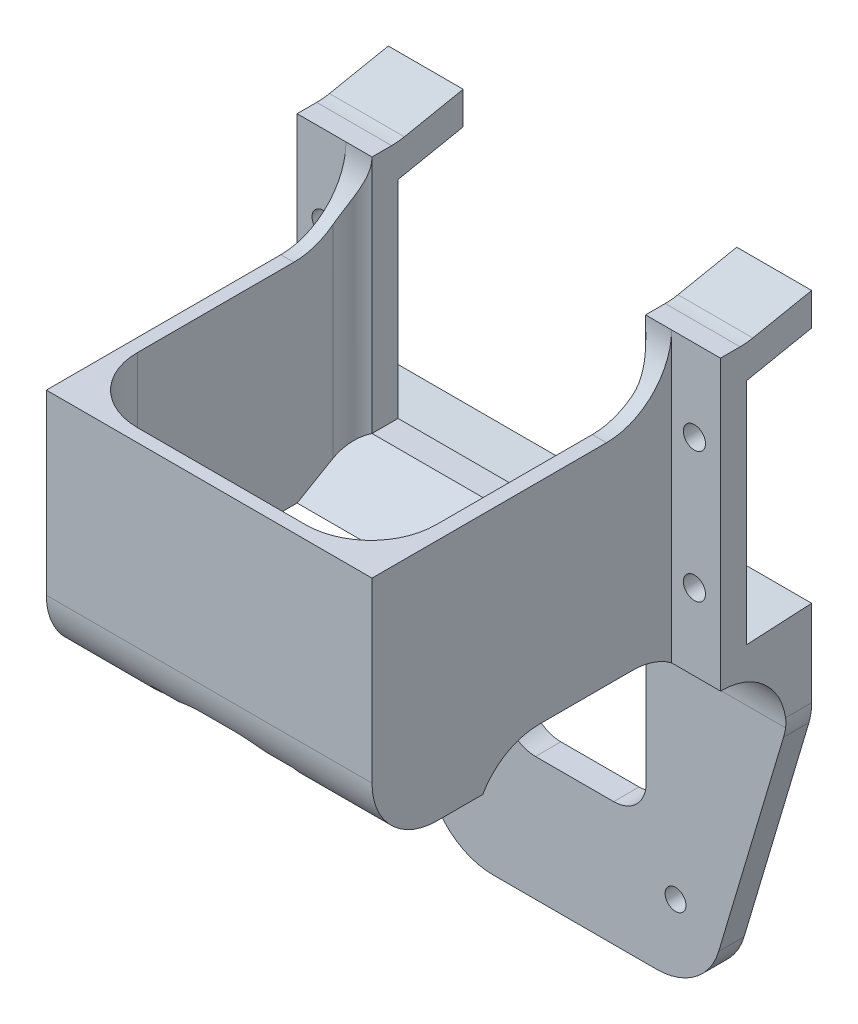
from build123d import *

# Parameters (mm, degrees)
SKETCH1_R            = 1.7
BOSS_EXTRUDE1_DEPTH  = 4
BOSS_EXTRUDE7_DEPTH  = 65
SKETCH9_W            = 42
SKETCH9_H            = 10.1
CUT_EXTRUDE2_DEPTH   = 2
SKETCH4_W            = 65
SKETCH4_H            = 3.9
BOSS_EXTRUDE3_DEPTH  = 52
SKETCH5_R            = 1.6
CUT_EXTRUDE1_DEPTH   = 50
BOSS_EXTRUDE8_START  = -10
BOSS_EXTRUDE8_DEPTH  = 32.27
FILLET1_R            = 10
BOSS_EXTRUDE9_DEPTH  = 11.5
BOSS_EXTRUDE12_START = -65
BOSS_EXTRUDE12_DEPTH = 11.5
FILLET5_R            = 10
SKETCH14_W           = 12
SKETCH14_H           = 15
SKETCH14_W_2         = 11.826086957
BOSS_EXTRUDE10_DEPTH = 5
FILLET3_R            = 10
SKETCH15_W           = 22
SKETCH15_H           = 30
CUT_EXTRUDE3_DEPTH   = 10
FILLET6_R            = 5
FILLET7_R            = 10
BOSS_EXTRUDE13_REACH = 95.361
FILLET8_R            = 10
FILLET9_R            = 5
FILLET10_START       = -2
FILLET10_DEPTH       = 32.27
FILLET10_START_2     = -32.5
FILLET10_2_DEPTH     = 65
FILLET10_START_3     = 20.99999979
FILLET10_3_DEPTH     = 4.00000021
FILLET10_START_4     = -25
FILLET10_4_DEPTH     = 4
FILLET10_START_5     = 30.27
FILLET10_5_DEPTH     = 12.000012257


with BuildPart() as part:
    # Sketch1 → Boss-Extrude1 (new body)
    with BuildSketch(Plane.XY):
        Polygon((-21, 40.27), (-21, 3.5), (21, 3.5), (21, 40.27), (32.5, 40.27), (32.5, 0), (-32.5, 0), (-32.5, 40.27), align=None)
        with Locations((-28.5, 27.73)):
            Circle(SKETCH1_R, mode=Mode.SUBTRACT)
        with Locations((-28.5, 7.73)):
            Circle(SKETCH1_R, mode=Mode.SUBTRACT)
        with Locations(Location((28.5, 7.73, 0), (0, 0, 180))):
            Circle(SKETCH1_R, mode=Mode.SUBTRACT)
        with Locations(Location((28.5, 27.73, 0), (0, 0, 180))):
            Circle(SKETCH1_R, mode=Mode.SUBTRACT)
    extrude(amount=BOSS_EXTRUDE1_DEPTH)

    # Sketch7 → Boss-Extrude7 (add)
    with BuildSketch(Plane(origin=(32.5, 0, 0), x_dir=(0, 0, -1), z_dir=(1, 0, 0))):
        Polygon((0, 0), (-4, 0), (-4, -4), (10, -4), (10, 0.674077793), (0, 0.15), align=None)
    extrude(amount=-BOSS_EXTRUDE7_DEPTH)

    # Sketch9 → Cut-Extrude2 (cut)
    with BuildSketch(Plane.XZ.offset(4)):
        with Locations((0, -1.05)):
            Rectangle(SKETCH9_W, SKETCH9_H)
    extrude(amount=-CUT_EXTRUDE2_DEPTH, mode=Mode.SUBTRACT)

    # Sketch4 → Boss-Extrude3 (add)
    with BuildSketch(Plane.XZ.offset(4)):
        with Locations((0, -8.05)):
            Rectangle(SKETCH4_W, SKETCH4_H)
    extrude(amount=BOSS_EXTRUDE3_DEPTH)

    # Sketch5 → Cut-Extrude1 (cut)
    with BuildSketch(Plane.XY.offset(-10)):
        with Locations(Location((-15.5, -45.25, 0), (0, 0, 180))):
            Circle(SKETCH5_R)
        with Locations(Location((15.5, -45.25, 0), (0, 0, 180))):
            Circle(SKETCH5_R)
    extrude(amount=CUT_EXTRUDE1_DEPTH, mode=Mode.SUBTRACT)

    # Sketch11 → Boss-Extrude8 (add)
    with BuildSketch(Plane(origin=(0, 40.27, 0), x_dir=(1, 0, 0), z_dir=(0, 1, 0)).offset(BOSS_EXTRUDE8_START)):
        Polygon((-23, -4), (-25, -4), (-25, -50), (25, -50), (25, -4), (22.826086957, -4), (22.826086957, -48), (-23, -48), align=None)
    extrude(amount=-BOSS_EXTRUDE8_DEPTH)

    # Fillet1
    fillet1_edges = [part.edges().sort_by_distance(p)[0] for p in [
        (-26.75, -4, -6.1),
        (26.75, -4, -6.1),
    ]]
    fillet(fillet1_edges, radius=FILLET1_R)

    # Sketch13 → Boss-Extrude9 (add)
    with BuildSketch(Plane(origin=(32.5, 0, 0), x_dir=(0, 0, -1), z_dir=(1, 0, 0))):
        Polygon((10, 42.270012257), (0, 40.27), (0, 35.27), (10, 37.270012257), align=None)
    extrude(amount=-BOSS_EXTRUDE9_DEPTH)

    # Sketch13<8> → Boss-Extrude12 (add)
    with BuildSketch(Plane(origin=(32.5, 0, 0), x_dir=(0, 0, -1), z_dir=(1, 0, 0)).offset(BOSS_EXTRUDE12_START)):
        Polygon((0, 40.27), (10, 42.270012257), (10, 37.270012257), (0, 35.27), align=None)
    extrude(amount=BOSS_EXTRUDE12_DEPTH)

    # Fillet5
    fillet5_edges = [part.edges().sort_by_distance(p)[0] for p in [
        (-26.75, 40.27, 0),
        (26.75, 40.27, 0),
    ]]
    fillet(fillet5_edges, radius=FILLET5_R)

    # Sketch14 → Boss-Extrude10 (add)
    with BuildSketch(Plane.XZ.offset(2)):
        with Locations((-17, 40.5)):
            Rectangle(SKETCH14_W, SKETCH14_H)
        with Locations((16.913043479, 40.5)):
            Rectangle(SKETCH14_W_2, SKETCH14_H)
        Polygon((25, 50), (11, 50), (11, 48), (22.826086957, 48), (22.826086957, 33), (25, 33), align=None)
        Polygon((-11, 50), (-25, 50), (-25, 33), (-23, 33), (-23, 48), (-11, 48), align=None)
    extrude(amount=BOSS_EXTRUDE10_DEPTH)

    # Fillet3
    # the kernel refuses this fillet: 10 mm, written as the material it adds along each edge
    with BuildSketch(Plane(origin=(22.826086957, -2, 33), x_dir=(0, -1, 0), z_dir=(1, 0, 0))) as fillet3_piece_1:
        with BuildLine():
            CenterArc((10, 8.660254038), FILLET3_R, 180, 60)
            Line((0, 8.660254038), (0, 0))
            Line((0, 0), (5, 0))
        make_face()
    extrude(amount=2.173913043)
    with BuildSketch(Plane(origin=(-25, -2, 33), x_dir=(0, -1, 0), z_dir=(1, 0, 0)), Plane(origin=(11, -2, 50), x_dir=(0, -1, 0), z_dir=(0, 0, -1))) as fillet3_piece_2:
        with BuildLine():
            CenterArc((10, 8.660254038), FILLET3_R, 180, 60)
            Line((0, 8.660254038), (0, 0))
            Line((0, 0), (5, 0))
        make_face()
    extrude(amount=2)
    with BuildSketch(Plane(origin=(-11, -2, 48), x_dir=(1, 0, 0), z_dir=(0, 0, 1))) as fillet3_piece_3:
        with BuildLine():
            CenterArc((8.660254038, -10), FILLET3_R, 90, 60)
            Line((0, -5), (0, 0))
            Line((0, 0), (8.660254038, 0))
        make_face()
    extrude(amount=2)

    # Sketch15 → Cut-Extrude3 (cut)
    with BuildSketch(Plane.XY.offset(-6.1)):
        with Locations((0, -22)):
            Rectangle(SKETCH15_W, SKETCH15_H)
        Polygon((-32.5, -14), (-20, -56), (-32.5, -56), align=None)
        Polygon((32.5, -56), (20, -56), (32.5, -14), align=None)
    extrude(amount=-CUT_EXTRUDE3_DEPTH, mode=Mode.SUBTRACT)

    # Fillet6
    fillet6_edges = [part.edges().sort_by_distance(p)[0] for p in [
        (-11, -37, -8.05),
        (-11, -7, -8.05),
        (11, -7, -8.05),
        (11, -37, -8.05),
    ]]
    fillet(fillet6_edges, radius=FILLET6_R)

    # Fillet7
    fillet7_edges = [part.edges().sort_by_distance(p)[0] for p in [
        (-20, -56, -8.05),
        (-32.5, -14, -8.05),
        (32.5, -14, -8.05),
        (20, -56, -8.05),
    ]]
    fillet(fillet7_edges, radius=FILLET7_R)

    # Boss-Extrude13: up to this face of the body (flat: up to its plane)
    boss_extrude13_end = Plane(part.part.faces().sort_by_distance((22.826086957, 13.980833311, 26.043580166))[0])
    # Sketch16 → Boss-Extrude13 (add, up to the picked face)
    with BuildSketch(Plane(origin=(-23, 0, 0), x_dir=(0, 0, -1), z_dir=(1, 0, 0)), mode=Mode.PRIVATE) as boss_extrude13_sk1:
        Polygon((-4, -2), (-4, 3.5), (-13.5, -2), align=None)
    boss_extrude13_tool1 = split(extrude(boss_extrude13_sk1.sketch, amount=BOSS_EXTRUDE13_REACH, mode=Mode.PRIVATE), bisect_by=boss_extrude13_end, keep=Keep.BOTH, mode=Mode.PRIVATE)
    add(boss_extrude13_tool1.solids().sort_by(Axis((-23, -0.166667, 7.166667), (1, 0, 0)))[0])

    # Fillet8
    # the kernel refuses this fillet: 10 mm, written as the material it adds along each edge
    with BuildSketch(Plane(origin=(-21, -2, 4), x_dir=(0, -1, 0), z_dir=(-1, 0, 0)), Plane(origin=(25, -2, 4), x_dir=(0, -1, 0), z_dir=(-1, 0, 0))) as fillet8_piece_1:
        with BuildLine():
            CenterArc((10, 6), FILLET8_R, 180, 36.869897646)
            Line((0, 6), (-0.2, 6))
            Line((-0.2, 6), (-0.2, 0))
            Line((-0.2, 0), (0, -0.2))
            ThreePointArc((0, -0.2), (1, -0.2), (1.84, -0.12))
            Line((1.84, -0.12), (2, 0))
        make_face()
    extrude(amount=4)

    # Fillet9
    # the kernel refuses this fillet: 5 mm, written as the material it adds along each edge
    with BuildSketch(Plane(origin=(22.826086957, 30.27, 4), x_dir=(-1, 0, 0), z_dir=(0, -1, 0))) as fillet9_piece_1_section:
        with BuildLine():
            CenterArc((5, -3.863453894), FILLET9_R, 129.403862825, 50.596137175)
            Line((0, -3.863453894), (0, 0))
            Line((0, 0), (1.826086957, 0))
        make_face()
    fillet9_piece_1 = extrude(amount=36.428634735, mode=Mode.PRIVATE)
    fillet9_piece_1 = split(fillet9_piece_1, bisect_by=Plane(origin=(22.826086957, -2, 4), z_dir=(0, 1, 0)), keep=Keep.TOP, mode=Mode.PRIVATE)
    add(fillet9_piece_1)
    with BuildSketch(Plane(origin=(-23, 30.27, 4), x_dir=(0, 0, 1), z_dir=(0, -1, 0))) as fillet9_piece_2_section:
        with BuildLine():
            CenterArc((4, -5), FILLET9_R, 90, 53.130102354)
            Line((0, -2), (0, 0))
            Line((0, 0), (4, 0))
        make_face()
    fillet9_piece_2 = extrude(amount=36.77, mode=Mode.PRIVATE)
    fillet9_piece_2 = split(fillet9_piece_2, bisect_by=Plane(origin=(-23, -2, 4), z_dir=(0, 1, 0)), keep=Keep.TOP, mode=Mode.PRIVATE)
    add(fillet9_piece_2)

    # Fillet10: read off the stored shape, not the designer's step
    # Fillet10 outline → Fillet10 (add)
    with BuildSketch(Plane(origin=(0, 0, 0), x_dir=(1, 0, 0), z_dir=(0, 1, 0)).offset(FILLET10_START)):
        with BuildLine():
            Line((-23, -48), (-13, -48))
            ThreePointArc((-13, -48), (-20.071067812, -45.071067812), (-23, -38))
            Line((-23, -38), (-23, -48))
        make_face()
        with BuildLine():
            ThreePointArc((22.826086957, -38), (19.897154769, -45.071067812), (12.826086957, -48))
            Line((12.826086957, -48), (22.826086957, -48))
            Line((22.826086957, -48), (22.826086957, -38))
        make_face()
    extrude(amount=FILLET10_DEPTH)

    # Fillet10 2 outline → Fillet10 2 (cut)
    with BuildSketch(Plane.YZ.offset(FILLET10_START_2)):
        with BuildLine():
            ThreePointArc((-7, 40), (-4.071067812, 47.071067812), (3, 50))
            Line((3, 50), (-7, 50))
            Line((-7, 50), (-7, 40))
        make_face()
    extrude(amount=FILLET10_2_DEPTH, mode=Mode.SUBTRACT)

    # Fillet10 3 outline → Fillet10 3 (add)
    with BuildSketch(Plane.YZ.offset(FILLET10_START_3)):
        with BuildLine():
            ThreePointArc((40.27, 4), (33.198932188, 6.928932188), (30.27, 14))
            Line((30.27, 14), (30.27, 4))
            Line((30.27, 4), (40.27, 4))
        make_face()
    extrude(amount=FILLET10_3_DEPTH)

    # Fillet10 4 outline → Fillet10 4 (add)
    with BuildSketch(Plane.YZ.offset(FILLET10_START_4)):
        with BuildLine():
            ThreePointArc((40.27, 4), (33.198932188, 6.928932188), (30.27, 14))
            Line((30.27, 14), (30.27, 4))
            Line((30.27, 4), (40.27, 4))
        make_face()
    extrude(amount=FILLET10_4_DEPTH)

    # Fillet10 5 outline → Fillet10 5 (cut)
    with BuildSketch(Plane(origin=(0, 0, 0), x_dir=(1, 0, 0), z_dir=(0, 1, 0)).offset(FILLET10_START_5)):
        with BuildLine():
            ThreePointArc((22.826086957, -7.863453894), (22.346570275, -5.726813876), (20.999994729, -3.99999567))
            Line((20.999994729, -3.99999567), (20.99999979, -14))
            Line((20.99999979, -14), (20.99999979, -15))
            Line((20.99999979, -15), (22.826086959, -15))
            Line((22.826086959, -15), (22.826086957, -7.863453894))
        make_face()
        with BuildLine():
            Line((-22.999999999, -15), (-21, -15))
            Line((-21, -15), (-21, -14))
            Line((-21, -14), (-20.9999923, -3.999994225))
            ThreePointArc((-20.9999923, -3.999994225), (-22.472133803, -5.763927718), (-23, -8))
            Line((-23, -8), (-22.999999999, -15))
        make_face()
    extrude(amount=FILLET10_5_DEPTH, mode=Mode.SUBTRACT)


solid = part.part
